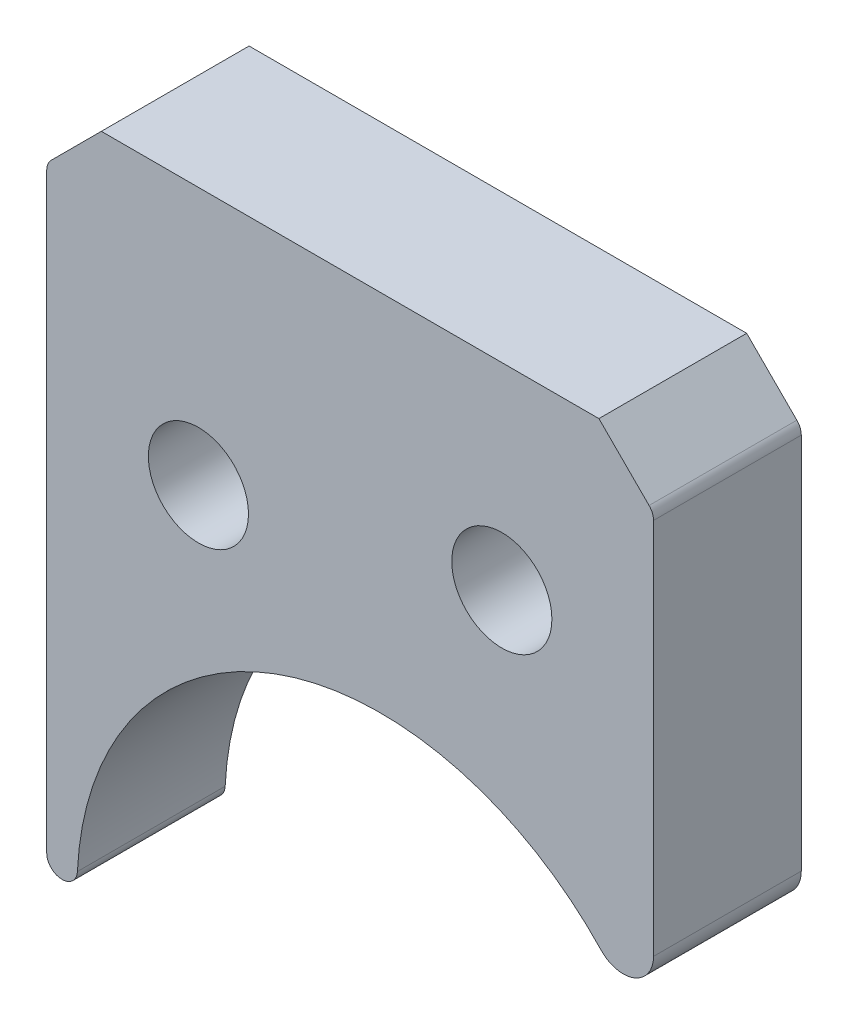
from build123d import *

# Parameters (mm, degrees)
BOSS_EXTRUDE1_DEPTH = 4.87
SKETCH2_R           = 1.65
CUT_EXTRUDE1_DEPTH  = 4.87
CHAMFER1_SIZE       = 1.8
FILLET1_R           = 0.5
FILLET2_R           = 1


with BuildPart() as part:
    # Sketch1 → Boss-Extrude1 (new body)
    with BuildSketch(Plane.XY):
        with BuildLine():
            Line((0, 22), (20, 22))
            Line((20, 22), (20, 4.35889894))
            ThreePointArc((20, 4.35889894), (8.763932024, 9.746794342), (1, 0))
            Line((1, 0), (0, 0))
            Line((0, 0), (0, 22))
        make_face()
    extrude(amount=BOSS_EXTRUDE1_DEPTH)

    # Sketch2 → Cut-Extrude1 (cut)
    with BuildSketch(Plane.XY.offset(4.87)):
        with Locations((5, 13.5)):
            Circle(SKETCH2_R)
        with Locations((15, 15.5)):
            Circle(SKETCH2_R)
    extrude(amount=-CUT_EXTRUDE1_DEPTH, mode=Mode.SUBTRACT)

    # Chamfer1
    chamfer1_edges = [part.edges().sort_by_distance(p)[0] for p in [
        (20, 22, 2.435),
        (0, 22, 2.435),
    ]]
    chamfer(chamfer1_edges, length=CHAMFER1_SIZE)

    # Fillet1
    fillet1_edges = [part.edges().sort_by_distance(p)[0] for p in [
        (0, 0, 2.435),
        (1, 0, 2.435),
        (0, 20.2, 2.435),
        (20, 20.2, 2.435),
    ]]
    fillet(fillet1_edges, radius=FILLET1_R)

    # Fillet2
    fillet2_edges = [part.edges().sort_by_distance(p)[0] for p in [
        (20, 4.35889894, 2.435),
    ]]
    fillet(fillet2_edges, radius=FILLET2_R)


solid = part.part
